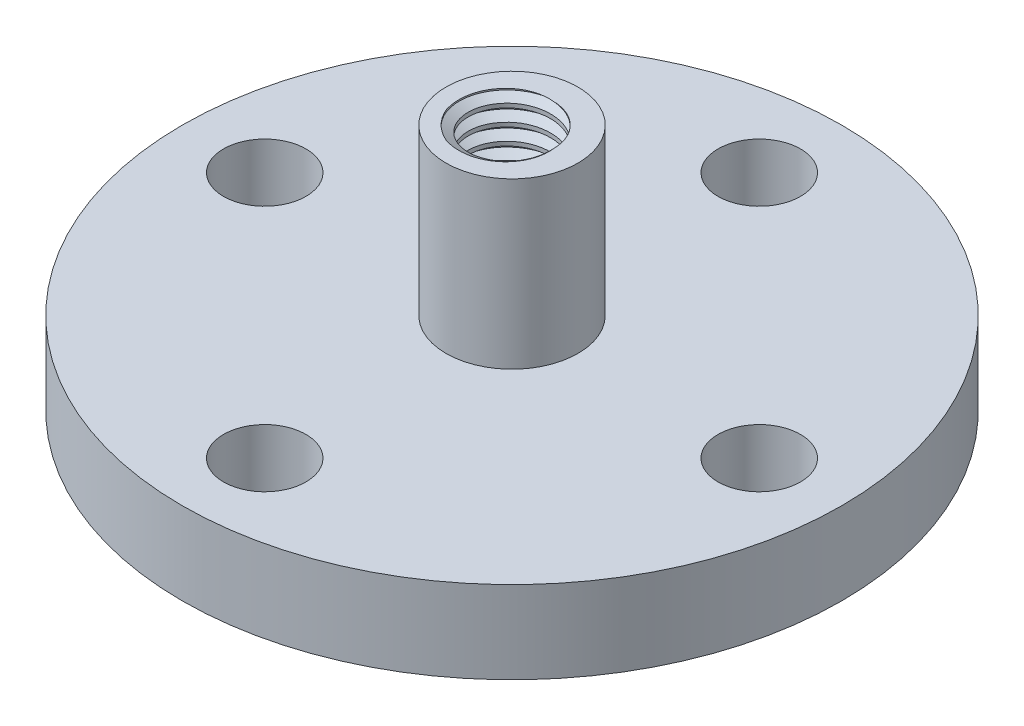
from build123d import *

# Parameters (mm, degrees)
SKETCH_1_R      = 20
SKETCH_1_R_2    = 2.5
EXTRUDE_1_DEPTH = 5
SKETCH_2_R      = 4
SKETCH_2_R_2    = 2.5
EXTRUDE_2_DEPTH = 10
THREAD_1_PITCH  = 1


with BuildPart() as part:
    # Sketch 1 → Бобышка-Вытянуть1 (new body)
    with BuildSketch(Plane(origin=(0, 0, 0), x_dir=(1, 0, 0), z_dir=(0, 1, 0))):
        with Locations(Location((0, 0, 0), (0, 0, 270))):
            Circle(SKETCH_1_R)
        with Locations(Location((15, 0, 0), (0, 0, 270))):
            Circle(SKETCH_1_R_2, mode=Mode.SUBTRACT)
        with Locations(Location((0, -15, 0), (0, 0, 270))):
            Circle(SKETCH_1_R_2, mode=Mode.SUBTRACT)
        with Locations(Location((-15, 0, 0), (0, 0, 270))):
            Circle(SKETCH_1_R_2, mode=Mode.SUBTRACT)
        with Locations(Location((0, 15, 0), (0, 0, 270))):
            Circle(SKETCH_1_R_2, mode=Mode.SUBTRACT)
    extrude(amount=EXTRUDE_1_DEPTH)

    # Эскиз2 → Бобышка-Вытянуть2 (add)
    with BuildSketch(Plane(origin=(0, 5, 0), x_dir=(1, 0, 0), z_dir=(0, 1, 0))):
        with Locations(Location((0, 0, 0), (0, 0, 270))):
            Circle(SKETCH_2_R)
        with Locations(Location((0, 0, 0), (0, 0, 270))):
            Circle(SKETCH_2_R_2, mode=Mode.SUBTRACT)
    extrude(amount=EXTRUDE_2_DEPTH)

    # Резьба1: the profile of Sketch 1 2 profile screwed along a right-hand helix of 10 turns, 8 arcs to a turn; built about Z, then put on its axis
    thread_1_z = Axis((0, 0, 0), (0, 0, 1))
    thread_1_corners = [(2.4997, 0, -0.000173205), (3.041265875, 0, 0.312499999), (3.041265875, 0, 0.437499999), (2.4997, 0, 0.750173202)]
    with BuildLine(mode=Mode.PRIVATE) as thread_1_profile:
        Line(thread_1_corners[0], thread_1_corners[1])
        Line(thread_1_corners[1], thread_1_corners[2])
        Line(thread_1_corners[2], thread_1_corners[3])
        Line(thread_1_corners[3], thread_1_corners[0])
    thread_1_cap = Face(thread_1_profile.wire())
    thread_1_turn_angles = [0, 22.5, 45, 67.5, 90, 112.5, 135, 157.5, 180, 202.5, 225, 247.5, 270, 292.5, 315, 337.5, 360]
    thread_1_turn_weights = [1, 0.9238795325112867, 1, 0.9238795325112867, 1, 0.9238795325112867, 1, 0.9238795325112867, 1, 0.9238795325112867, 1, 0.9238795325112867, 1, 0.9238795325112867, 1, 0.9238795325112867, 1]
    thread_1_turn_rails = [Edge.make_bspline([Vector(p[0], p[1], 0).rotate(thread_1_z, thread_1_turn_angles[k]) / thread_1_turn_weights[k] + Vector(0, 0, p[2] + THREAD_1_PITCH * thread_1_turn_angles[k] / 360) for k in range(17)], [0, 0, 0, 1, 1, 2, 2, 3, 3, 4, 4, 5, 5, 6, 6, 7, 7, 8, 8, 8], 2, thread_1_turn_weights) for p in thread_1_corners]
    thread_1_turn_sides = [Face.make_surface_from_curves(thread_1_turn_rails[p[0]], thread_1_turn_rails[p[1]]) for p in [(0, 1), (1, 2), (2, 3), (3, 0)]]
    thread_1 = Plane(origin=(0, 5, 0), x_dir=(1, 0, 0), z_dir=(0, 1, 0)) * Solid(Shell([*[p.moved(Location((0, 0, THREAD_1_PITCH * i))) for i in range(10) for p in thread_1_turn_sides], thread_1_cap, thread_1_cap.rotate(thread_1_z, 3600).moved(Location((0, 0, THREAD_1_PITCH * 3600 / 360)))]))
    add(thread_1, mode=Mode.SUBTRACT)


solid = part.part
